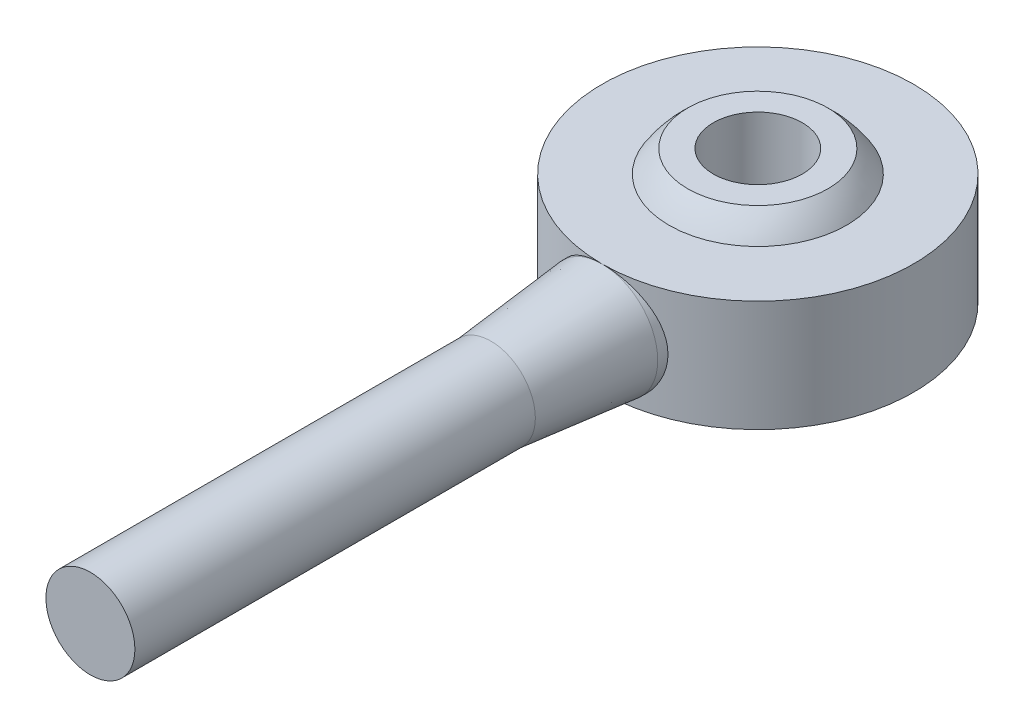
from build123d import *

# Parameters (mm, degrees)
SKETCH1_R           = 7
SKETCH1_R_2         = 3.25
BOSS_EXTRUDE1_DEPTH = 2.5


with BuildPart() as part:
    # Sketch1 → Boss-Extrude1 (new, symmetric)
    with BuildSketch(Plane(origin=(0, 0, 0), x_dir=(1, 0, 0), z_dir=(0, 1, 0))):
        Circle(SKETCH1_R)
        Circle(SKETCH1_R_2, mode=Mode.SUBTRACT)
    extrude(amount=BOSS_EXTRUDE1_DEPTH, both=True)

    # Sketch2 → Revolve1 (revolve)
    with BuildSketch(Plane(origin=(0, 0, 0), x_dir=(0, 0, -1), z_dir=(1, 0, 0))):
        with BuildLine():
            Line((-3.15, 3.5), (-2, 3.5))
            Line((-2, 3.5), (-2, -3.5))
            Line((-2, -3.5), (-3.15, -3.5))
            ThreePointArc((-3.15, -3.5), (-4.708768416, 0), (-3.15, 3.5))
        make_face()
    revolve(axis=Axis((0, 6, 0), (0, -1, 0)))

    # Sketch3 → Revolve2 (revolve)
    with BuildSketch(Plane(origin=(0, 0, 0), x_dir=(0, 0, -1), z_dir=(1, 0, 0))):
        Polygon((-12, 2), (-7, 2.5), (-5, 2.5), (-5, 0), (-30, 0), (-30, 2), align=None)
    revolve(axis=Axis((0, 0, 30), (0, 0, -1)))


solid = part.part
